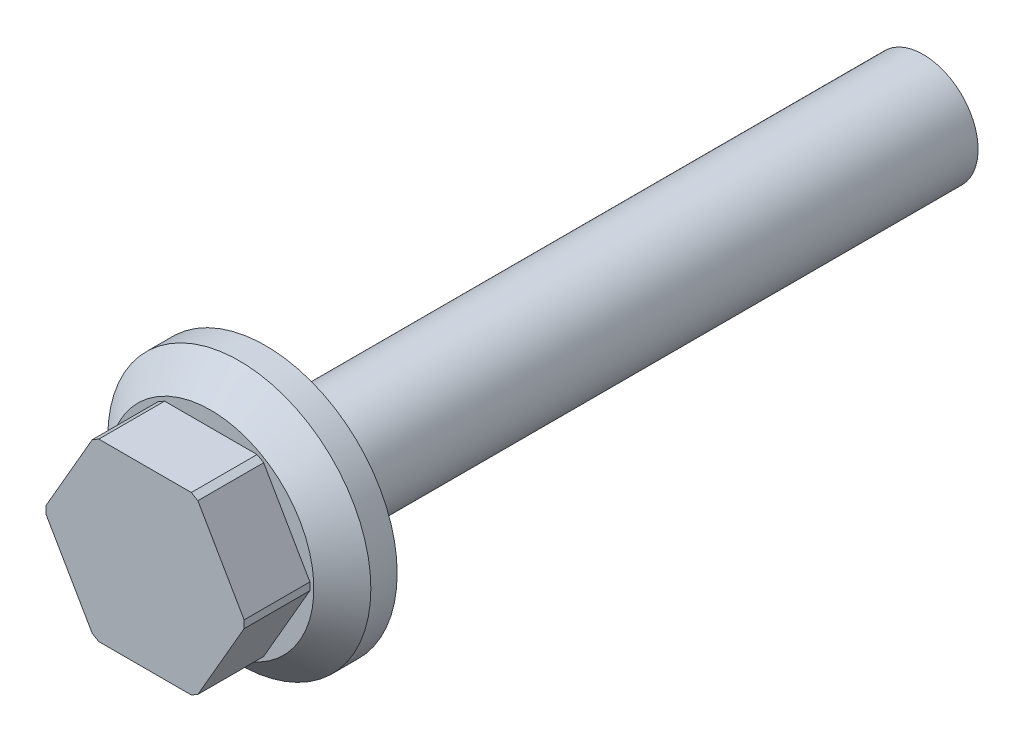
from build123d import *

# Parameters (mm, degrees)
SKETCH1_W                = 2.5
SKETCH1_H                = 30
SKETCH2_R                = 6
BOSS_EXTRUDE1_DEPTH      = 1
SKETCH3_R                = 4.4
BOSS_EXTRUDE2_DEPTH      = 1.5
CHAMFER1_SIZE            = 1.8
BOSS_EXTRUDE3_DEPTH      = 3
BOSS_EXTRUDE3_DEPTH_BACK = 1.5
CHAMFER2_SIZE            = 0.2
CHAMFER2_EDGE_2_SIZE     = 0.2
CHAMFER2_EDGE_3_SIZE     = 0.2
CHAMFER2_EDGE_4_SIZE     = 0.2
CHAMFER2_EDGE_5_SIZE     = 0.2
CHAMFER2_EDGE_6_SIZE     = 0.2


with BuildPart() as part:
    # Sketch1 → Revolve1 (revolve)
    with BuildSketch(Plane(origin=(0, 0, 0), x_dir=(1, 0, 0), z_dir=(0, 1, 0)), mode=Mode.PRIVATE) as revolve1_sk:
        with Locations((1.25, 15)):
            Rectangle(SKETCH1_W, SKETCH1_H)
    revolve(revolve1_sk.sketch.rotate(Axis((0, 0, -30), (0, 0, 1)), 180), axis=Axis((0, 0, -30), (0, 0, 1)))

    # Sketch2 → Boss-Extrude1 (add)
    with BuildSketch(Plane.XY):
        Circle(SKETCH2_R)
    extrude(amount=BOSS_EXTRUDE1_DEPTH)

    # Sketch3 → Boss-Extrude2 (add)
    with BuildSketch(Plane.XY.offset(1)):
        Circle(SKETCH3_R)
    extrude(amount=BOSS_EXTRUDE2_DEPTH)

    # Chamfer1
    # the kernel refuses this chamfer: 1.8 mm, written as the material it adds along each edge
    with BuildSketch(Plane(origin=(0, 0, 1), x_dir=(1, 0, 0), z_dir=(0, -1, 0))) as chamfer1_piece_1_section:
        Polygon((4.4 + CHAMFER1_SIZE, 0), (4.4, CHAMFER1_SIZE), (4.4, 0), align=None)
    chamfer1_piece_1 = revolve(axis=Axis((0, 0, 1), (0, 0, 1)), mode=Mode.PRIVATE)
    chamfer1_piece_1 = chamfer1_piece_1 & Plane(origin=(0, 0, 1.82351745), x_dir=(1, 0, 0), z_dir=(0, 0, -1)) * Cylinder(6, 25, mode=Mode.PRIVATE)
    chamfer1_piece_1 = split(chamfer1_piece_1, bisect_by=Plane(origin=(-5.32351745, 0, 2.5), z_dir=(0, 0, -1)), keep=Keep.TOP, mode=Mode.PRIVATE)
    add(chamfer1_piece_1)

    # Sketch4 → Boss-Extrude3 (add, two sides: drawn at the far end of the back side and taken through both)
    with BuildSketch(Plane.XY.offset(2.5).offset(-BOSS_EXTRUDE3_DEPTH_BACK)):
        Polygon((-2.309401077, 4), (-4.618802154, 0), (-2.309401077, -4), (2.309401077, -4), (4.618802154, 0), (2.309401077, 4), align=None)
    extrude(amount=BOSS_EXTRUDE3_DEPTH + BOSS_EXTRUDE3_DEPTH_BACK)

    # Chamfer2
    chamfer2_edges = [part.edges().sort_by_distance(p)[0] for p in [
        (-2.309401077, 4, 4),
    ]]
    chamfer(chamfer2_edges, length=CHAMFER2_SIZE)

    # Chamfer2 edge 2
    chamfer2_edge_2_edges = [part.edges().sort_by_distance(p)[0] for p in [
        (2.309401077, 4, 4),
    ]]
    chamfer(chamfer2_edge_2_edges, length=CHAMFER2_EDGE_2_SIZE)

    # Chamfer2 edge 3
    chamfer2_edge_3_edges = [part.edges().sort_by_distance(p)[0] for p in [
        (4.618802154, 0, 4),
    ]]
    chamfer(chamfer2_edge_3_edges, length=CHAMFER2_EDGE_3_SIZE)

    # Chamfer2 edge 4
    chamfer2_edge_4_edges = [part.edges().sort_by_distance(p)[0] for p in [
        (2.309401077, -4, 4),
    ]]
    chamfer(chamfer2_edge_4_edges, length=CHAMFER2_EDGE_4_SIZE)

    # Chamfer2 edge 5
    chamfer2_edge_5_edges = [part.edges().sort_by_distance(p)[0] for p in [
        (-2.309401077, -4, 4),
    ]]
    chamfer(chamfer2_edge_5_edges, length=CHAMFER2_EDGE_5_SIZE)

    # Chamfer2 edge 6
    chamfer2_edge_6_edges = [part.edges().sort_by_distance(p)[0] for p in [
        (-4.618802154, 0, 4),
    ]]
    chamfer(chamfer2_edge_6_edges, length=CHAMFER2_EDGE_6_SIZE)


solid = part.part
